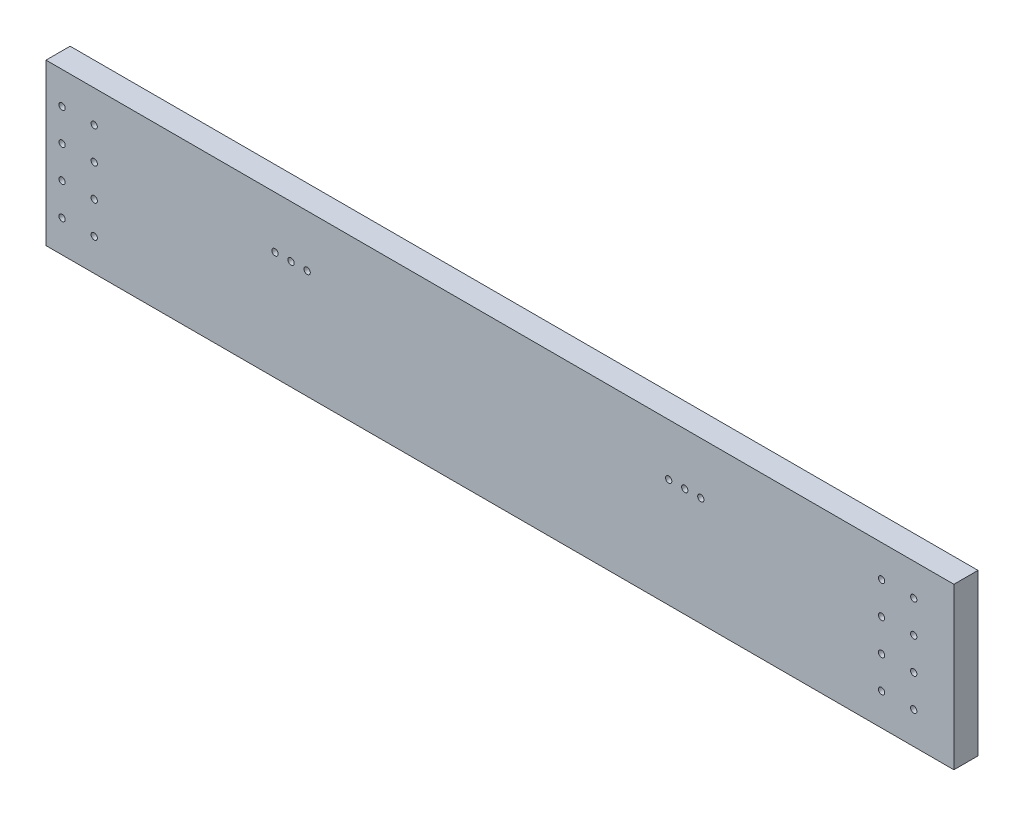
from build123d import *

# Parameters (mm, degrees)
SKETCH1_W           = 717.55
SKETCH1_H           = 127
BOSS_EXTRUDE1_DEPTH = 19.05
SKETCH2_R           = 2.4892
CUT_EXTRUDE1_DEPTH  = 25.4
SKETCH4_R           = 2.4892
CUT_EXTRUDE2_DEPTH  = 729.951236366


with BuildPart() as part:
    # Sketch1 → Boss-Extrude1 (new body)
    with BuildSketch(Plane.XY):
        with Locations((358.775, 63.5)):
            Rectangle(SKETCH1_W, SKETCH1_H)
    extrude(amount=BOSS_EXTRUDE1_DEPTH)

    # Sketch2 → Cut-Extrude1 (cut)
    with BuildSketch(Plane.XY.offset(19.05)):
        with Locations((12.7, 101.6)):
            Circle(SKETCH2_R)
        with Locations((38.1, 101.6)):
            Circle(SKETCH2_R)
        with Locations((38.1, 76.2)):
            Circle(SKETCH2_R)
        with Locations((38.1, 50.8)):
            Circle(SKETCH2_R)
        with Locations((38.1, 25.4)):
            Circle(SKETCH2_R)
        with Locations((12.7, 76.2)):
            Circle(SKETCH2_R)
        with Locations((12.7, 50.8)):
            Circle(SKETCH2_R)
        with Locations((12.7, 25.4)):
            Circle(SKETCH2_R)
        with Locations((685.8, 101.6)):
            Circle(SKETCH2_R)
        with Locations((660.4, 101.6)):
            Circle(SKETCH2_R)
        with Locations((660.4, 76.2)):
            Circle(SKETCH2_R)
        with Locations((660.4, 50.8)):
            Circle(SKETCH2_R)
        with Locations((660.4, 25.4)):
            Circle(SKETCH2_R)
        with Locations((685.8, 76.2)):
            Circle(SKETCH2_R)
        with Locations((685.8, 50.8)):
            Circle(SKETCH2_R)
        with Locations((685.8, 25.4)):
            Circle(SKETCH2_R)
    extrude(amount=-CUT_EXTRUDE1_DEPTH, mode=Mode.SUBTRACT)

    # Sketch4 → Cut-Extrude2 (cut, through all)
    with BuildSketch(Plane.XY.offset(19.05)):
        with Locations((180.975, 85.979)):
            Circle(SKETCH4_R)
        with Locations((193.675, 85.979)):
            Circle(SKETCH4_R)
        with Locations((206.375, 85.979)):
            Circle(SKETCH4_R)
        with Locations((492.125, 85.979)):
            Circle(SKETCH4_R)
        with Locations((504.825, 85.979)):
            Circle(SKETCH4_R)
        with Locations((517.525, 85.979)):
            Circle(SKETCH4_R)
    extrude(amount=-CUT_EXTRUDE2_DEPTH, mode=Mode.SUBTRACT)


solid = part.part
